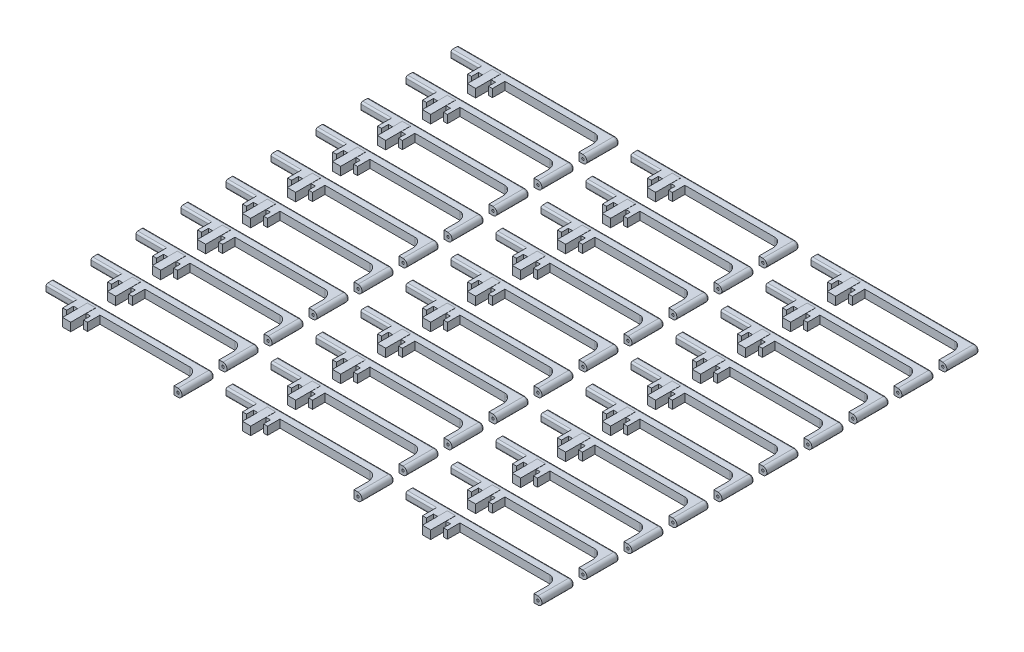
from build123d import *

# Parameters (mm, degrees)
SKETCH_1_W               = 2.4
SKETCH_1_H               = 2.4
EXTRUDE_1_DEPTH          = 7.2
EXTRUDE_2_DEPTH          = 32
EXTRUDE_2_DEPTH_BACK     = 12
SKETCH_4_W               = 2.3
SKETCH_4_H               = 2.3
EXTRUDE_3_DEPTH          = 7
EXTRUDE_3_DEPTH_BACK     = 2.3
SKETCH_5_R               = 0.35
SKETCH_6_R               = 0.35
CUT_EXTRUDE_1_DEPTH      = 10
FILLET_1_SIZE            = 2.4
FILLET_1_SIZE_2          = 3.2
FILLET_2_R               = 0.5
EXTRUDE_START            = -1.5
SKETCH_7_W               = 1.15
SKETCH_7_H               = 0.5
SKETCH_7_H_2             = 1.3
SKETCH_7_H_3             = 2.3
EXTRUDE_4_DEPTH          = 5.1
SKETCH_8_W               = 7.2
SKETCH_8_H               = 2.3
EXTRUDE_5_DEPTH          = 3.1
PATTERN_LINEAR_1_COUNT   = 10
PATTERN_LINEAR_1_PITCH   = 13
PATTERN_LINEAR_1_2_COUNT = 3
PATTERN_LINEAR_1_2_PITCH = 52


with BuildPart() as part:
    # 草图1 → 凸台-拉伸1 (new body)
    with BuildSketch(Plane.XY):
        Rectangle(SKETCH_1_W, SKETCH_1_H)
    extrude(amount=EXTRUDE_1_DEPTH)

    # 草图4 → 凸台-拉伸2 (add, two sides: drawn at the far end of the back side and taken through both)
    with BuildSketch(Plane(origin=(0, 0, 0), x_dir=(0, 0, -1), z_dir=(1, 0, 0)).offset(-EXTRUDE_2_DEPTH_BACK)):
        Rectangle(SKETCH_4_W, SKETCH_4_H)
    extrude(amount=EXTRUDE_2_DEPTH + EXTRUDE_2_DEPTH_BACK)

    # 草图5 → 凸台-拉伸3 (add, two sides: drawn at the far end of the back side and taken through both)
    with BuildSketch(Plane.XY.offset(1.15).offset(-EXTRUDE_3_DEPTH_BACK)):
        with BuildLine():
            Line((32, 0), (32, 1.15))
            Line((32, 1.15), (33.15, 1.15))
            ThreePointArc((33.15, 1.15), (34.3, 0), (33.15, -1.15))
            Line((33.15, -1.15), (32, -1.15))
            Line((32, -1.15), (32, 0))
        make_face()
        with Locations(Location((33.15, 0, 0), (0, 0, 180))):
            Circle(SKETCH_5_R, mode=Mode.SUBTRACT)
    extrude(amount=EXTRUDE_3_DEPTH + EXTRUDE_3_DEPTH_BACK)

    # 草图6 → 切除-拉伸1 (cut)
    with BuildSketch(Plane.ZY.offset(12)):
        Circle(SKETCH_6_R)
    extrude(amount=-CUT_EXTRUDE_1_DEPTH, mode=Mode.SUBTRACT)

    # 圆角1
    # an asymmetric fillet: 3.2, 2.4 mm, written as the material it adds along each edge
    with BuildSketch(Plane(origin=(32, 1.15, 1.15), x_dir=(-1, 0, 0), z_dir=(0, -1, 0))) as fillet_1_piece_1:
        with BuildLine():
            Bezier((FILLET_1_SIZE, 0), (0, 0), (0, -FILLET_1_SIZE_2), weights=[1, 0.707106781, 1])
            Line((0, -FILLET_1_SIZE_2), (0, 0))
            Line((0, 0), (FILLET_1_SIZE, 0))
        make_face()
    extrude(amount=2.3)

    # 圆角2
    fillet_2_edges = [part.edges().sort_by_distance(p)[0] for p in [
        (-6.6, -1.15, 1.15),
        (10.575, -1.15, -1.15),
        (-6.6, 1.15, 1.15),
        (10.575, 1.15, -1.15),
        (34.3, 0, -1.15),
    ]]
    fillet(fillet_2_edges, radius=FILLET_2_R)

    # 草图7 → 凸台-拉伸4 (add)
    with BuildSketch(Plane.XY.offset(1.15).offset(EXTRUDE_START)):
        with Locations((-3.025, 0.9)):
            Rectangle(SKETCH_7_W, SKETCH_7_H)
        with Locations((-3.025, 0)):
            Rectangle(SKETCH_7_W, SKETCH_7_H_2)
        with Locations((-3.025, -0.9)):
            Rectangle(SKETCH_7_W, SKETCH_7_H)
        with Locations((3.025, 0)):
            Rectangle(SKETCH_7_W, SKETCH_7_H_3)
    extrude(amount=EXTRUDE_4_DEPTH)

    # 草图8 → 凸台-拉伸5 (add)
    with BuildSketch(Plane.XY.offset(1.15).offset(EXTRUDE_START)):
        Rectangle(SKETCH_8_W, SKETCH_8_H)
    extrude(amount=EXTRUDE_5_DEPTH)


with BuildPart() as pattern_linear_1_1:
    # 阵列(线性)1: pattern copy
    add(part.part.moved(Location(Vector(0, 0, 1) * (1 * PATTERN_LINEAR_1_PITCH))))


with BuildPart() as pattern_linear_1_2:
    # 阵列(线性)1: pattern copy
    add(part.part.moved(Location(Vector(0, 0, 1) * (2 * PATTERN_LINEAR_1_PITCH))))


with BuildPart() as pattern_linear_1_3:
    # 阵列(线性)1: pattern copy
    add(part.part.moved(Location(Vector(0, 0, 1) * (3 * PATTERN_LINEAR_1_PITCH))))


with BuildPart() as pattern_linear_1_4:
    # 阵列(线性)1: pattern copy
    add(part.part.moved(Location(Vector(0, 0, 1) * (4 * PATTERN_LINEAR_1_PITCH))))


with BuildPart() as pattern_linear_1_5:
    # 阵列(线性)1: pattern copy
    add(part.part.moved(Location(Vector(0, 0, 1) * (5 * PATTERN_LINEAR_1_PITCH))))


with BuildPart() as pattern_linear_1_6:
    # 阵列(线性)1: pattern copy
    add(part.part.moved(Location(Vector(0, 0, 1) * (6 * PATTERN_LINEAR_1_PITCH))))


with BuildPart() as pattern_linear_1_7:
    # 阵列(线性)1: pattern copy
    add(part.part.moved(Location(Vector(0, 0, 1) * (7 * PATTERN_LINEAR_1_PITCH))))


with BuildPart() as pattern_linear_1_8:
    # 阵列(线性)1: pattern copy
    add(part.part.moved(Location(Vector(0, 0, 1) * (8 * PATTERN_LINEAR_1_PITCH))))


with BuildPart() as pattern_linear_1_9:
    # 阵列(线性)1: pattern copy
    add(part.part.moved(Location(Vector(0, 0, 1) * (9 * PATTERN_LINEAR_1_PITCH))))


with BuildPart() as pattern_linear_1_2_1:
    # Pattern Linear 1 2: pattern copy
    add(part.part.moved(Location(Vector(1, 0, 0) * (1 * PATTERN_LINEAR_1_2_PITCH))))


with BuildPart() as pattern_linear_1_2_2:
    # Pattern Linear 1 2: pattern copy
    add(part.part.moved(Location(Vector(1, 0, 0) * (2 * PATTERN_LINEAR_1_2_PITCH))))


with BuildPart() as pattern_linear_1_2_3:
    # Pattern Linear 1 2: pattern copy
    add(pattern_linear_1_1.part.moved(Location(Vector(1, 0, 0) * (1 * PATTERN_LINEAR_1_2_PITCH))))


with BuildPart() as pattern_linear_1_2_4:
    # Pattern Linear 1 2: pattern copy
    add(pattern_linear_1_1.part.moved(Location(Vector(1, 0, 0) * (2 * PATTERN_LINEAR_1_2_PITCH))))


with BuildPart() as pattern_linear_1_2_5:
    # Pattern Linear 1 2: pattern copy
    add(pattern_linear_1_2.part.moved(Location(Vector(1, 0, 0) * (1 * PATTERN_LINEAR_1_2_PITCH))))


with BuildPart() as pattern_linear_1_2_6:
    # Pattern Linear 1 2: pattern copy
    add(pattern_linear_1_2.part.moved(Location(Vector(1, 0, 0) * (2 * PATTERN_LINEAR_1_2_PITCH))))


with BuildPart() as pattern_linear_1_2_7:
    # Pattern Linear 1 2: pattern copy
    add(pattern_linear_1_3.part.moved(Location(Vector(1, 0, 0) * (1 * PATTERN_LINEAR_1_2_PITCH))))


with BuildPart() as pattern_linear_1_2_8:
    # Pattern Linear 1 2: pattern copy
    add(pattern_linear_1_3.part.moved(Location(Vector(1, 0, 0) * (2 * PATTERN_LINEAR_1_2_PITCH))))


with BuildPart() as pattern_linear_1_2_9:
    # Pattern Linear 1 2: pattern copy
    add(pattern_linear_1_4.part.moved(Location(Vector(1, 0, 0) * (1 * PATTERN_LINEAR_1_2_PITCH))))


with BuildPart() as pattern_linear_1_2_10:
    # Pattern Linear 1 2: pattern copy
    add(pattern_linear_1_4.part.moved(Location(Vector(1, 0, 0) * (2 * PATTERN_LINEAR_1_2_PITCH))))


with BuildPart() as pattern_linear_1_2_11:
    # Pattern Linear 1 2: pattern copy
    add(pattern_linear_1_5.part.moved(Location(Vector(1, 0, 0) * (1 * PATTERN_LINEAR_1_2_PITCH))))


with BuildPart() as pattern_linear_1_2_12:
    # Pattern Linear 1 2: pattern copy
    add(pattern_linear_1_5.part.moved(Location(Vector(1, 0, 0) * (2 * PATTERN_LINEAR_1_2_PITCH))))


with BuildPart() as pattern_linear_1_2_13:
    # Pattern Linear 1 2: pattern copy
    add(pattern_linear_1_6.part.moved(Location(Vector(1, 0, 0) * (1 * PATTERN_LINEAR_1_2_PITCH))))


with BuildPart() as pattern_linear_1_2_14:
    # Pattern Linear 1 2: pattern copy
    add(pattern_linear_1_6.part.moved(Location(Vector(1, 0, 0) * (2 * PATTERN_LINEAR_1_2_PITCH))))


with BuildPart() as pattern_linear_1_2_15:
    # Pattern Linear 1 2: pattern copy
    add(pattern_linear_1_7.part.moved(Location(Vector(1, 0, 0) * (1 * PATTERN_LINEAR_1_2_PITCH))))


with BuildPart() as pattern_linear_1_2_16:
    # Pattern Linear 1 2: pattern copy
    add(pattern_linear_1_7.part.moved(Location(Vector(1, 0, 0) * (2 * PATTERN_LINEAR_1_2_PITCH))))


with BuildPart() as pattern_linear_1_2_17:
    # Pattern Linear 1 2: pattern copy
    add(pattern_linear_1_8.part.moved(Location(Vector(1, 0, 0) * (1 * PATTERN_LINEAR_1_2_PITCH))))


with BuildPart() as pattern_linear_1_2_18:
    # Pattern Linear 1 2: pattern copy
    add(pattern_linear_1_8.part.moved(Location(Vector(1, 0, 0) * (2 * PATTERN_LINEAR_1_2_PITCH))))


with BuildPart() as pattern_linear_1_2_19:
    # Pattern Linear 1 2: pattern copy
    add(pattern_linear_1_9.part.moved(Location(Vector(1, 0, 0) * (1 * PATTERN_LINEAR_1_2_PITCH))))


with BuildPart() as pattern_linear_1_2_20:
    # Pattern Linear 1 2: pattern copy
    add(pattern_linear_1_9.part.moved(Location(Vector(1, 0, 0) * (2 * PATTERN_LINEAR_1_2_PITCH))))


solid = Compound([part.part, pattern_linear_1_1.part, pattern_linear_1_2.part, pattern_linear_1_3.part, pattern_linear_1_4.part, pattern_linear_1_5.part, pattern_linear_1_6.part, pattern_linear_1_7.part, pattern_linear_1_8.part, pattern_linear_1_9.part, pattern_linear_1_2_1.part, pattern_linear_1_2_2.part, pattern_linear_1_2_3.part, pattern_linear_1_2_4.part, pattern_linear_1_2_5.part, pattern_linear_1_2_6.part, pattern_linear_1_2_7.part, pattern_linear_1_2_8.part, pattern_linear_1_2_9.part, pattern_linear_1_2_10.part, pattern_linear_1_2_11.part, pattern_linear_1_2_12.part, pattern_linear_1_2_13.part, pattern_linear_1_2_14.part, pattern_linear_1_2_15.part, pattern_linear_1_2_16.part, pattern_linear_1_2_17.part, pattern_linear_1_2_18.part, pattern_linear_1_2_19.part, pattern_linear_1_2_20.part])
